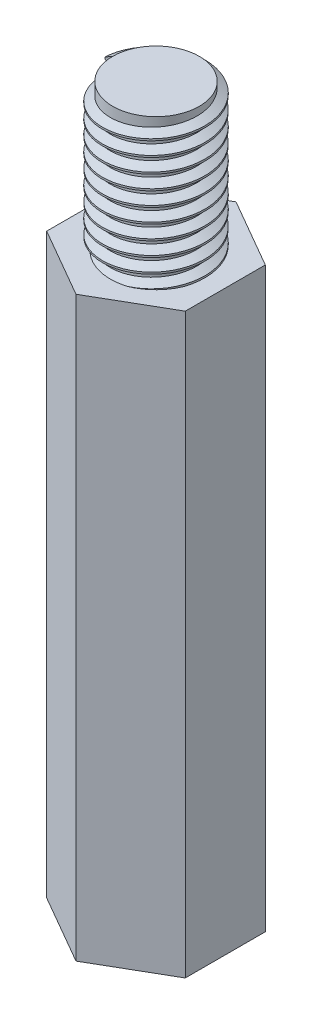
from build123d import *

# Parameters (mm, degrees)
SKETCH1_R           = 1.25
BOSS_EXTRUDE1_DEPTH = 5
THREAD1_PITCH       = 0.5
BOSS_EXTRUDE2_DEPTH = 15
SKETCH3_R           = 1.5
BOSS_EXTRUDE3_DEPTH = 5
THREAD2_PITCH       = 0.5


with BuildPart() as part:
    # Sketch1 → Boss-Extrude1 (new body)
    with BuildSketch(Plane(origin=(0, 0, 0), x_dir=(1, 0, 0), z_dir=(0, 1, 0))):
        Polygon((2.4, 1.385640646), (0, 2.771281292), (-2.4, 1.385640646), (-2.4, -1.385640646), (0, -2.771281292), (2.4, -1.385640646), align=None)
        with Locations(Location((0, 0, 0), (0, 0, 270))):
            Circle(SKETCH1_R, mode=Mode.SUBTRACT)
    extrude(amount=BOSS_EXTRUDE1_DEPTH)

    # Thread1: the profile of Thread Profile1 profile screwed along a right-hand helix of 44 turns, 6 arcs to a turn; built about Z, then put on its axis
    thread1_z = Axis((0, 0, 0), (0, 0, 1))
    thread1_corners = [(1.2497, 0, -0.000173205), (1.520632938, 0, 0.156249999), (1.520632937, 0, 0.218749999), (1.2497, 0, 0.375173204)]
    with BuildLine(mode=Mode.PRIVATE) as thread1_profile:
        Line(thread1_corners[0], thread1_corners[1])
        Line(thread1_corners[1], thread1_corners[2])
        Line(thread1_corners[2], thread1_corners[3])
        Line(thread1_corners[3], thread1_corners[0])
    thread1_cap = Face(thread1_profile.wire())
    thread1_turn_angles = [0, 30, 60, 90, 120, 150, 180, 210, 240, 270, 300, 330, 360, 390, 420, 450, 480, 510, 540, 570, 600, 630, 660, 690, 720]
    thread1_turn_weights = [1, 0.8660254037844387, 1, 0.8660254037844387, 1, 0.8660254037844387, 1, 0.8660254037844387, 1, 0.8660254037844387, 1, 0.8660254037844387, 1, 0.8660254037844387, 1, 0.8660254037844387, 1, 0.8660254037844387, 1, 0.8660254037844387, 1, 0.8660254037844387, 1, 0.8660254037844387, 1]
    thread1_turn_rails = [Edge.make_bspline([Vector(p[0], p[1], 0).rotate(thread1_z, thread1_turn_angles[k]) / thread1_turn_weights[k] + Vector(0, 0, p[2] + THREAD1_PITCH * thread1_turn_angles[k] / 360) for k in range(25)], [0, 0, 0, 1, 1, 2, 2, 3, 3, 4, 4, 5, 5, 6, 6, 7, 7, 8, 8, 9, 9, 10, 10, 11, 11, 12, 12, 12], 2, thread1_turn_weights) for p in thread1_corners]
    thread1_turn_sides = [Face.make_surface_from_curves(thread1_turn_rails[p[0]], thread1_turn_rails[p[1]]) for p in [(0, 1), (1, 2), (2, 3), (3, 0)]]
    thread1 = Plane(origin=(0, 7, 0), x_dir=(-1, 0, 0), z_dir=(0, -1, 0)) * Solid(Shell([*[p.moved(Location((0, 0, 2 * THREAD1_PITCH * i))) for i in range(22) for p in thread1_turn_sides], thread1_cap, thread1_cap.rotate(thread1_z, 15840).moved(Location((0, 0, THREAD1_PITCH * 15840 / 360)))]))
    add(thread1, mode=Mode.SUBTRACT)

    # Sketch2 → Boss-Extrude2 (add)
    with BuildSketch(Plane(origin=(0, 5, 0), x_dir=(1, 0, 0), z_dir=(0, 1, 0))):
        Polygon((2.4, -1.385640646), (2.4, 1.385640646), (0, 2.771281292), (-2.4, 1.385640646), (-2.4, -1.385640646), (0, -2.771281292), align=None)
    extrude(amount=BOSS_EXTRUDE2_DEPTH)

    # Sketch3 → Boss-Extrude3 (add)
    with BuildSketch(Plane(origin=(0, 20, 0), x_dir=(1, 0, 0), z_dir=(0, 1, 0))):
        with Locations(Location((0, 0, 0), (0, 0, 270))):
            Circle(SKETCH3_R)
    extrude(amount=BOSS_EXTRUDE3_DEPTH)

    # Thread2: the profile of Thread Profile2 profile screwed along a right-hand helix of 20 turns, 6 arcs to a turn; built about Z, then put on its axis
    thread2_z = Axis((0, 0, 0), (0, 0, 1))
    thread2_corners = [(1.4997, 0, -0.000173205), (1.770632938, 0, 0.156249999), (1.770632938, 0, 0.218749999), (1.4997, 0, 0.375173204)]
    with BuildLine(mode=Mode.PRIVATE) as thread2_profile:
        Line(thread2_corners[0], thread2_corners[1])
        Line(thread2_corners[1], thread2_corners[2])
        Line(thread2_corners[2], thread2_corners[3])
        Line(thread2_corners[3], thread2_corners[0])
    thread2_cap = Face(thread2_profile.wire())
    thread2_turn_angles = [0, 30, 60, 90, 120, 150, 180, 210, 240, 270, 300, 330, 360]
    thread2_turn_weights = [1, 0.8660254037844387, 1, 0.8660254037844387, 1, 0.8660254037844387, 1, 0.8660254037844387, 1, 0.8660254037844387, 1, 0.8660254037844387, 1]
    thread2_turn_rails = [Edge.make_bspline([Vector(p[0], p[1], 0).rotate(thread2_z, thread2_turn_angles[k]) / thread2_turn_weights[k] + Vector(0, 0, p[2] + THREAD2_PITCH * thread2_turn_angles[k] / 360) for k in range(13)], [0, 0, 0, 1, 1, 2, 2, 3, 3, 4, 4, 5, 5, 6, 6, 6], 2, thread2_turn_weights) for p in thread2_corners]
    thread2_turn_sides = [Face.make_surface_from_curves(thread2_turn_rails[p[0]], thread2_turn_rails[p[1]]) for p in [(0, 1), (1, 2), (2, 3), (3, 0)]]
    thread2 = Plane(origin=(0, 25, 0), x_dir=(-1, 0, 0), z_dir=(0, -1, 0)) * Solid(Shell([*[p.moved(Location((0, 0, THREAD2_PITCH * i))) for i in range(20) for p in thread2_turn_sides], thread2_cap, thread2_cap.rotate(thread2_z, 7200).moved(Location((0, 0, THREAD2_PITCH * 7200 / 360)))]))
    add(thread2)


solid = part.part
